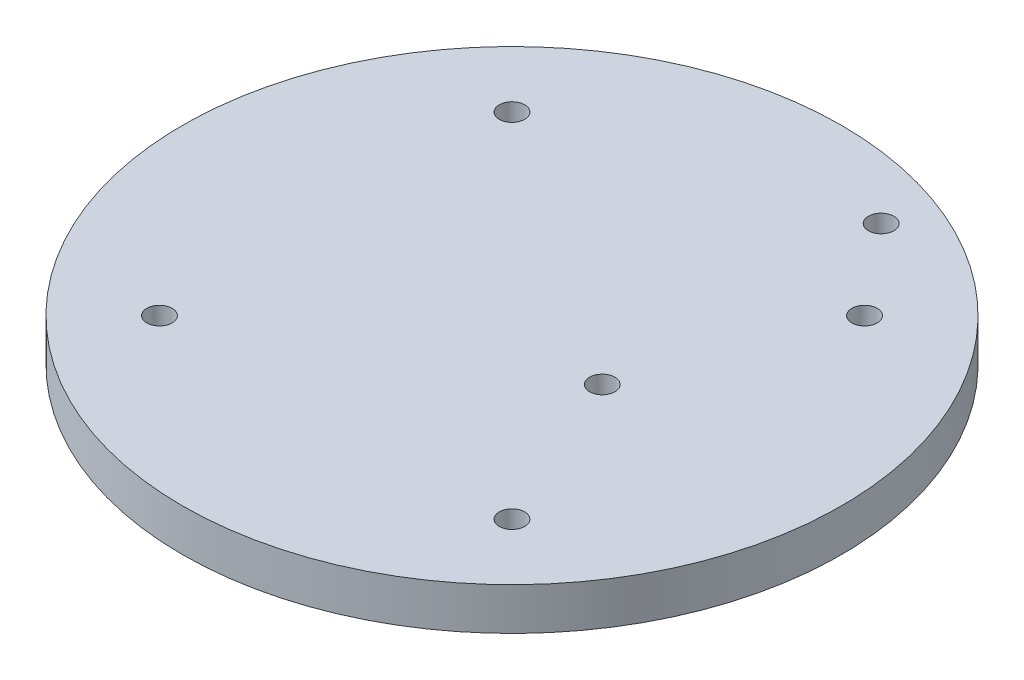
from build123d import *

# Parameters (mm, degrees)
ESQUISSE1_R             = 39
BOSS_EXTRU_1_DEPTH      = 5
ESQUISSE2_R             = 1.5
ENL_V_MAT_EXTRU_1_DEPTH = 56.380501984


with BuildPart() as part:
    # Esquisse1 → Boss.-Extru.1 (new body)
    with BuildSketch(Plane(origin=(0, 0, 0), x_dir=(1, 0, 0), z_dir=(0, 1, 0))):
        Circle(ESQUISSE1_R)
    extrude(amount=BOSS_EXTRU_1_DEPTH)

    # Esquisse2 → Enlèv. mat.-Extru.1 (cut, through all)
    with BuildSketch(Plane.XZ):
        with Locations((20.859650045, 20.859650045)):
            Circle(ESQUISSE2_R)
        with Locations((20.859650045, -20.859650045)):
            Circle(ESQUISSE2_R)
        with Locations((-20.859650045, -20.859650045)):
            Circle(ESQUISSE2_R)
        with Locations((-20.859650045, 20.859650045)):
            Circle(ESQUISSE2_R)
        with Locations((12.4, -31.282873123)):
            Circle(ESQUISSE2_R)
        with Locations((12.4, 1.717126877)):
            Circle(ESQUISSE2_R)
    extrude(amount=-ENL_V_MAT_EXTRU_1_DEPTH, mode=Mode.SUBTRACT)


solid = part.part
